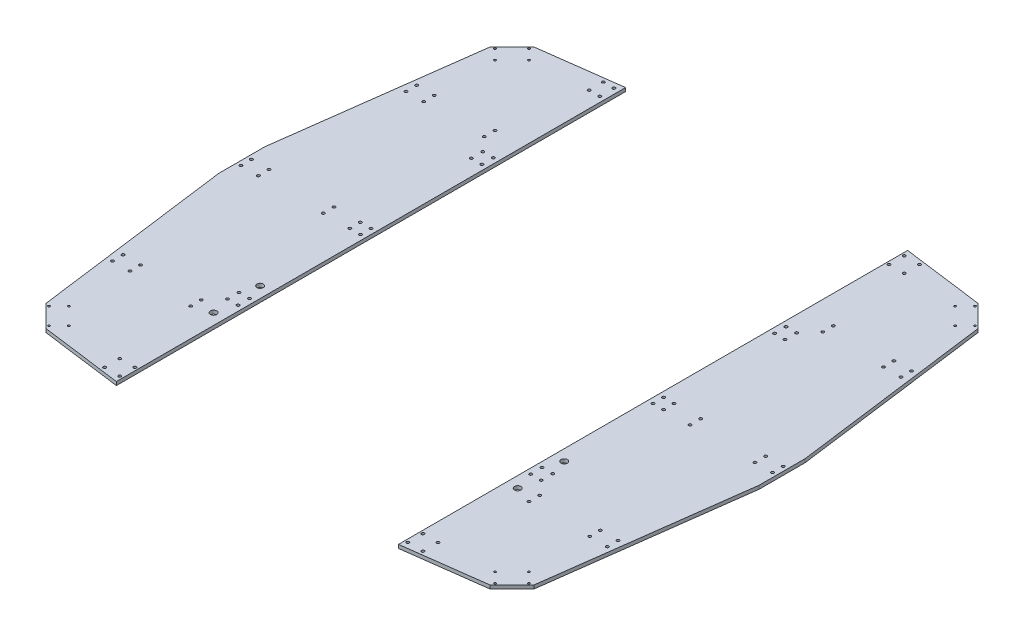
from build123d import *

# Parameters (mm, degrees)
SKETCH_1_R               = 1.5
SKETCH_1_R_2             = 2.000000001
SKETCH_1_R_3             = 2
SKETCH_1_R_4             = 4.5
SKETCH_1_R_5             = 2.000000002
SKETCH_1_R_6             = 1.999999998
SKETCH_1_R_7             = 250
SKETCH_1_R_8             = 1.999999999
EXTRUDE_2_DEPTH          = 5
CUT_EXTRUDE_1_DEPTH      = 542.772616539
CUT_EXTRUDE_1_DEPTH_BACK = 122
CUT_EXTRUDE_2_DEPTH      = 527.431195247
CUT_EXTRUDE_2_DEPTH_BACK = 39
SKETCH_3_R               = 2.000000001
CUT_EXTRUDE_3_DEPTH      = 20
CUT_EXTRUDE_3_DEPTH_BACK = 527.431195247
SKETCH_4_R               = 2
SKETCH_5_R               = 2
EXTRUDE_3_DEPTH          = 5


with BuildPart() as part:
    # 草图1 → 凸台-拉伸2 (new body)
    with BuildSketch(Plane(origin=(0, 0, 0), x_dir=(1, 0, 0), z_dir=(0, 1, 0))):
        Polygon((-32.720120418, 383.074776011), (-314.922171201, 345.922171201), (-345.922171201, 314.922171201), (-383.074776011, 32.720120418), (-383.074776011, -32.720120418), (-345.922171201, -314.922171201), (-314.922171201, -345.922171201), (-32.720120418, -383.074776011), (32.720120418, -383.074776011), (314.922171201, -345.922171201), (345.922171201, -314.922171201), (383.074776011, -32.720120418), (383.074776011, 32.720120418), (345.922171201, 314.922171201), (314.922171201, 345.922171201), (32.720120418, 383.074776011), (0, 383.074776011), align=None)
        with Locations((-316.280035574, -340.321666135)):
            Circle(SKETCH_1_R, mode=Mode.SUBTRACT)
        with Locations((-340.321666134, -316.280035574)):
            Circle(SKETCH_1_R, mode=Mode.SUBTRACT)
        with Locations((-302.137899951, -326.179530511)):
            Circle(SKETCH_1_R, mode=Mode.SUBTRACT)
        with Locations((-326.179530511, -302.137899951)):
            Circle(SKETCH_1_R, mode=Mode.SUBTRACT)
        with Locations((-350.918362047, -215.681953431)):
            Circle(SKETCH_1_R_2, mode=Mode.SUBTRACT)
        with Locations((-350.918362047, -200.681953431)):
            Circle(SKETCH_1_R_2, mode=Mode.SUBTRACT)
        with Locations((-325.918362047, -215.681953431)):
            Circle(SKETCH_1_R_2, mode=Mode.SUBTRACT)
        with Locations((-325.918362047, -200.681953431)):
            Circle(SKETCH_1_R_2, mode=Mode.SUBTRACT)
        with Locations((-240, -215.681953429)):
            Circle(SKETCH_1_R_3, mode=Mode.SUBTRACT)
        with Locations((-240, -200.681953429)):
            Circle(SKETCH_1_R_3, mode=Mode.SUBTRACT)
        with Locations((-215.612697258, -207.55428794)):
            Circle(SKETCH_1_R_4, mode=Mode.SUBTRACT)
        with Locations((-222.5, -181.030079822)):
            Circle(SKETCH_1_R_3, mode=Mode.SUBTRACT)
        with Locations((-207.5, -181.030079822)):
            Circle(SKETCH_1_R_3, mode=Mode.SUBTRACT)
        with Locations((-222.5, -164.825516547)):
            Circle(SKETCH_1_R_3, mode=Mode.SUBTRACT)
        with Locations((-207.5, -164.825516547)):
            Circle(SKETCH_1_R_3, mode=Mode.SUBTRACT)
        with Locations((-215.612697258, -141.55428794)):
            Circle(SKETCH_1_R_4, mode=Mode.SUBTRACT)
        with Locations((-377.074776011, -7.499878938)):
            Circle(SKETCH_1_R_3, mode=Mode.SUBTRACT)
        with Locations((-352.074776011, -7.499878938)):
            Circle(SKETCH_1_R_3, mode=Mode.SUBTRACT)
        with Locations((-260, -7.5)):
            Circle(SKETCH_1_R_3, mode=Mode.SUBTRACT)
        with Locations((316.280035574, -340.321666135)):
            Circle(SKETCH_1_R, mode=Mode.SUBTRACT)
        with Locations((302.13789995, -326.179530511)):
            Circle(SKETCH_1_R, mode=Mode.SUBTRACT)
        with Locations((326.179530511, -302.137899951)):
            Circle(SKETCH_1_R, mode=Mode.SUBTRACT)
        with Locations((340.321666135, -316.280035574)):
            Circle(SKETCH_1_R, mode=Mode.SUBTRACT)
        with Locations((215.612697258, -207.55428794)):
            Circle(SKETCH_1_R_4, mode=Mode.SUBTRACT)
        with Locations((240, -215.681953429)):
            Circle(SKETCH_1_R_3, mode=Mode.SUBTRACT)
        with Locations((240, -200.681953429)):
            Circle(SKETCH_1_R_3, mode=Mode.SUBTRACT)
        with Locations((325.918362047, -215.681953432)):
            Circle(SKETCH_1_R_5, mode=Mode.SUBTRACT)
        with Locations((325.918362047, -200.681953432)):
            Circle(SKETCH_1_R_5, mode=Mode.SUBTRACT)
        with Locations((350.918362047, -215.681953432)):
            Circle(SKETCH_1_R_5, mode=Mode.SUBTRACT)
        with Locations((350.918362047, -200.681953432)):
            Circle(SKETCH_1_R_5, mode=Mode.SUBTRACT)
        with Locations((207.5, -181.030079822)):
            Circle(SKETCH_1_R_3, mode=Mode.SUBTRACT)
        with Locations((222.5, -181.030079822)):
            Circle(SKETCH_1_R_3, mode=Mode.SUBTRACT)
        with Locations((207.5, -164.825516547)):
            Circle(SKETCH_1_R_3, mode=Mode.SUBTRACT)
        with Locations((222.5, -164.825516547)):
            Circle(SKETCH_1_R_3, mode=Mode.SUBTRACT)
        with Locations((215.612697258, -141.55428794)):
            Circle(SKETCH_1_R_4, mode=Mode.SUBTRACT)
        with Locations((260, -7.5)):
            Circle(SKETCH_1_R_3, mode=Mode.SUBTRACT)
        with Locations((352.074776011, -7.595099646)):
            Circle(SKETCH_1_R_3, mode=Mode.SUBTRACT)
        with Locations((377.074776011, -7.595099646)):
            Circle(SKETCH_1_R_3, mode=Mode.SUBTRACT)
        with Locations((-377.074776011, 7.500121062)):
            Circle(SKETCH_1_R_3, mode=Mode.SUBTRACT)
        with Locations((-352.074776011, 7.500121062)):
            Circle(SKETCH_1_R_3, mode=Mode.SUBTRACT)
        with Locations((-260, 7.5)):
            Circle(SKETCH_1_R_3, mode=Mode.SUBTRACT)
        with Locations((-222.5, 164.825516547)):
            Circle(SKETCH_1_R_3, mode=Mode.SUBTRACT)
        with Locations((-207.5, 164.825516547)):
            Circle(SKETCH_1_R_3, mode=Mode.SUBTRACT)
        with Locations((-222.5, 181.030079822)):
            Circle(SKETCH_1_R_3, mode=Mode.SUBTRACT)
        with Locations((-207.5, 181.030079822)):
            Circle(SKETCH_1_R_3, mode=Mode.SUBTRACT)
        with Locations((-350.918362047, 200.681953431)):
            Circle(SKETCH_1_R_6, mode=Mode.SUBTRACT)
        with Locations((-350.918362047, 215.681953431)):
            Circle(SKETCH_1_R_6, mode=Mode.SUBTRACT)
        with Locations((-325.918362047, 200.681953431)):
            Circle(SKETCH_1_R_6, mode=Mode.SUBTRACT)
        with Locations((-325.918362047, 215.681953431)):
            Circle(SKETCH_1_R_6, mode=Mode.SUBTRACT)
        with Locations((-240, 200.681953428)):
            Circle(SKETCH_1_R_3, mode=Mode.SUBTRACT)
        with Locations((-240, 215.681953428)):
            Circle(SKETCH_1_R_3, mode=Mode.SUBTRACT)
        with Locations((-340.321666134, 316.280035574)):
            Circle(SKETCH_1_R, mode=Mode.SUBTRACT)
        with Locations((-326.179530511, 302.137899951)):
            Circle(SKETCH_1_R, mode=Mode.SUBTRACT)
        with Locations((-302.13789995, 326.179530511)):
            Circle(SKETCH_1_R, mode=Mode.SUBTRACT)
        with Locations((-316.280035574, 340.321666134)):
            Circle(SKETCH_1_R, mode=Mode.SUBTRACT)
        Circle(SKETCH_1_R_7, mode=Mode.SUBTRACT)
        with Locations((260, 7.5)):
            Circle(SKETCH_1_R_3, mode=Mode.SUBTRACT)
        with Locations((352.074776011, 7.500121062)):
            Circle(SKETCH_1_R_3, mode=Mode.SUBTRACT)
        with Locations((377.074776011, 7.500121062)):
            Circle(SKETCH_1_R_3, mode=Mode.SUBTRACT)
        with Locations((207.5, 164.825516547)):
            Circle(SKETCH_1_R_3, mode=Mode.SUBTRACT)
        with Locations((222.5, 164.825516547)):
            Circle(SKETCH_1_R_3, mode=Mode.SUBTRACT)
        with Locations((207.5, 181.030079822)):
            Circle(SKETCH_1_R_3, mode=Mode.SUBTRACT)
        with Locations((222.5, 181.030079822)):
            Circle(SKETCH_1_R_3, mode=Mode.SUBTRACT)
        with Locations((240, 200.681953428)):
            Circle(SKETCH_1_R_3, mode=Mode.SUBTRACT)
        with Locations((240, 215.681953428)):
            Circle(SKETCH_1_R_3, mode=Mode.SUBTRACT)
        with Locations((325.918362047, 200.681953431)):
            Circle(SKETCH_1_R_8, mode=Mode.SUBTRACT)
        with Locations((325.918362047, 215.681953431)):
            Circle(SKETCH_1_R_8, mode=Mode.SUBTRACT)
        with Locations((350.918362047, 200.681953431)):
            Circle(SKETCH_1_R_8, mode=Mode.SUBTRACT)
        with Locations((350.918362047, 215.681953431)):
            Circle(SKETCH_1_R_8, mode=Mode.SUBTRACT)
        with Locations((326.179530511, 302.13789995)):
            Circle(SKETCH_1_R, mode=Mode.SUBTRACT)
        with Locations((302.137899951, 326.179530511)):
            Circle(SKETCH_1_R, mode=Mode.SUBTRACT)
        with Locations((340.321666135, 316.280035574)):
            Circle(SKETCH_1_R, mode=Mode.SUBTRACT)
        with Locations((316.280035574, 340.321666134)):
            Circle(SKETCH_1_R, mode=Mode.SUBTRACT)
    extrude(amount=EXTRUDE_2_DEPTH)

    # 草图2 → 切除-拉伸1 (cut, two sides: drawn at the far end of the back side and taken through both)
    with BuildSketch(Plane(origin=(0, 5, 0), x_dir=(1, 0, 0), z_dir=(0, 1, 0)).offset(-CUT_EXTRUDE_1_DEPTH_BACK)):
        Polygon((-200, 484.714921051), (-200, 361.051962068), (-200, -361.051962068), (-200, -418.819036359), (200, -418.819036359), (200, -361.051962068), (200, 361.051962068), (200, 484.714921051), align=None)
    extrude(amount=CUT_EXTRUDE_1_DEPTH + CUT_EXTRUDE_1_DEPTH_BACK, mode=Mode.SUBTRACT)


with BuildPart() as cut_extrude_1_piece_1:
    # of the separate pieces the step leaves, piece 1, a body of its own (cut_extrude_1_pieces)
    add(part.part.solids().sort_by_distance((-314.922171201, 0, 345.922171201))[0])

    # 草图3 → 切除-拉伸2 (cut, two sides: drawn at the far end of the back side and taken through both)
    with BuildSketch(Plane(origin=(0, 0, 0), x_dir=(-1, 0, 0), z_dir=(0, -1, 0)).offset(-CUT_EXTRUDE_2_DEPTH_BACK)):
        with Locations((225.752728604, -352.02249242)):
            Circle(SKETCH_3_R)
        with Locations((204.247271395, -352.02249242)):
            Circle(SKETCH_3_R)
        with Locations((225.752728604, -330.517035211)):
            Circle(SKETCH_3_R)
        with Locations((204.247271395, -330.517035211)):
            Circle(SKETCH_3_R)
    extrude(amount=CUT_EXTRUDE_2_DEPTH + CUT_EXTRUDE_2_DEPTH_BACK, mode=Mode.SUBTRACT)


with BuildPart() as cut_extrude_1_piece_2:
    # of the separate pieces the step leaves, piece 2, a body of its own (cut_extrude_1_pieces)
    add(part.part.solids().sort_by_distance((200, 0, 361.051962068))[0])


with BuildPart() as cut_extrude_3_tool:
    # 草图4 → 切除-拉伸3 (new, two sides: drawn at the far end of the back side and taken through both)
    with BuildSketch(Plane(origin=(0, 5, 0), x_dir=(1, 0, 0), z_dir=(0, 1, 0)).offset(-CUT_EXTRUDE_3_DEPTH_BACK)):
        with Locations((-207.5, 352.018568286)):
            Circle(SKETCH_4_R)
        with Locations((-222.5, 352.018568286)):
            Circle(SKETCH_4_R)
        with Locations((-222.5, 332.018568286)):
            Circle(SKETCH_4_R)
        with Locations((-207.5, 332.018568286)):
            Circle(SKETCH_4_R)
        with Locations((204.247271395, 330.513111077)):
            Circle(SKETCH_4_R)
        with Locations((225.752728605, 330.513111077)):
            Circle(SKETCH_4_R)
        with Locations((204.247271395, 352.018568286)):
            Circle(SKETCH_4_R)
        with Locations((225.752728605, 352.018568286)):
            Circle(SKETCH_4_R)
        with Locations((204.247271396, -352.02249242)):
            Circle(SKETCH_4_R)
        with Locations((225.752728605, -352.02249242)):
            Circle(SKETCH_4_R)
        with Locations((204.247271396, -330.517035211)):
            Circle(SKETCH_4_R)
        with Locations((225.752728605, -330.517035211)):
            Circle(SKETCH_4_R)
    extrude(amount=CUT_EXTRUDE_3_DEPTH + CUT_EXTRUDE_3_DEPTH_BACK)


with BuildPart() as cut_extrude_1_piece_1_1:
    add(cut_extrude_1_piece_1.part)

    # 切除-拉伸3: cut by cut_extrude_3_tool
    add(cut_extrude_3_tool.part, mode=Mode.SUBTRACT)



with BuildPart() as cut_extrude_1_piece_2_1:
    add(cut_extrude_1_piece_2.part)

    # 切除-拉伸3: cut by cut_extrude_3_tool
    add(cut_extrude_3_tool.part, mode=Mode.SUBTRACT)


with BuildPart() as cut_extrude_1_piece_1_2:
    add(cut_extrude_1_piece_1_1.part)

    add(cut_extrude_1_piece_2_1.part)  # 凸台-拉伸3 merges 切除-拉伸1 piece 2
    # 草图5 → 凸台-拉伸3 (add)
    # profile 1 of 2: a face of its own
    with BuildSketch(Plane(origin=(0, 5, 0), x_dir=(1, 0, 0), z_dir=(0, 1, 0))):
        with BuildLine():
            Line((-200, 7.5), (-200, 150))
            ThreePointArc((-200, 150), (-250, 0), (-200, -150))
            Line((-200, -150), (-200, -7.5))
            Line((-200, -7.5), (-200, 7.5))
        make_face()
        with Locations((-222.5, -7.5)):
            Circle(SKETCH_5_R, mode=Mode.SUBTRACT)
        with Locations((-207.5, -7.5)):
            Circle(SKETCH_5_R, mode=Mode.SUBTRACT)
        with Locations((-222.5, 7.5)):
            Circle(SKETCH_5_R, mode=Mode.SUBTRACT)
        with Locations((-207.5, 7.5)):
            Circle(SKETCH_5_R, mode=Mode.SUBTRACT)
    # profile 2 of 2: a face of its own
    with BuildSketch(Plane(origin=(0, 5, 0), x_dir=(1, 0, 0), z_dir=(0, 1, 0))):
        with BuildLine():
            ThreePointArc((200, -150), (250, 0), (200, 150))
            Line((200, 150), (200, -150))
        make_face()
        with Locations((207.5, -7.5)):
            Circle(SKETCH_5_R, mode=Mode.SUBTRACT)
        with Locations((222.5, -7.5)):
            Circle(SKETCH_5_R, mode=Mode.SUBTRACT)
        with Locations((207.5, 7.5)):
            Circle(SKETCH_5_R, mode=Mode.SUBTRACT)
        with Locations((222.5, 7.5)):
            Circle(SKETCH_5_R, mode=Mode.SUBTRACT)
    extrude(amount=-EXTRUDE_3_DEPTH)


solid = cut_extrude_1_piece_1_2.part
